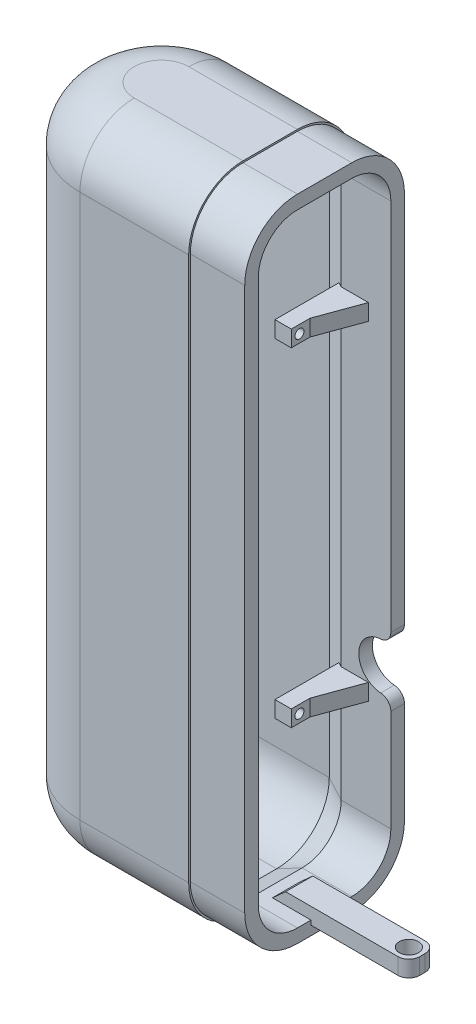
from build123d import *
from OCP.BRepFilletAPI import BRepFilletAPI_MakeChamfer

# Parameters (mm, degrees)
BOSS_EXTRUDE1_DEPTH      = 76.2
FILLET1_R                = 12.7
SHELL1_T                 = -0.4
EXTRUDE_THIN1_DEPTH      = 12.7
EXTRUDE_THIN1_DEPTH_BACK = 6.35
CHAMFER1_SIZE            = 7.46
CHAMFER1_SIZE_2          = 3.96655236
SKETCH6_W                = 17.539309582
SKETCH6_H                = 3.81
SKETCH6_R                = 1.054294776
BOSS_EXTRUDE3_DEPTH      = 3.81
CHAMFER2_SIZE            = 10
CHAMFER2_SIZE2           = 3.639702343
SKETCH7_W                = 33.02
SKETCH7_H                = 6.35
BOSS_EXTRUDE4_DEPTH      = 3.81
CHAMFER3_SIZE            = 3.81
CHAMFER3_SIZE_2          = 4.231433681
SKETCH8_R                = 2.25
CUT_EXTRUDE1_DEPTH       = 160.403972974
FILLET2_R                = 2.54
SKETCH9_R                = 5.461
CUT_EXTRUDE2_DEPTH       = 104.511048806
FILLET3_R                = 2.54


with BuildPart() as part:
    # Sketch1 → Boss-Extrude1 (new, symmetric)
    with BuildSketch(Plane(origin=(0, 0, 0), x_dir=(1, 0, 0), z_dir=(0, 1, 0))):
        with BuildLine():
            Line((0, -19.05), (25.4, -19.05))
            Line((25.4, -19.05), (25.4, 19.05))
            Line((25.4, 19.05), (0, 19.05))
            ThreePointArc((0, 19.05), (-19.05, 0), (0, -19.05))
        make_face()
    extrude(amount=BOSS_EXTRUDE1_DEPTH, both=True)

    # Fillet1
    fillet1_edges = [part.edges().sort_by_distance(p)[0] for p in [
        (12.7, 76.2, -19.05),
        (-19.05, 76.2, 0),
        (12.7, -76.2, -19.05),
        (12.7, -76.2, 19.05),
        (-19.05, -76.2, 0),
        (12.7, 76.2, 19.05),
    ]]
    fillet(fillet1_edges, radius=FILLET1_R)

    # Shell1
    shell1_openings = [part.faces().sort_by_distance(p)[0] for p in [
        (25.4, 0, 0),
    ]]
    offset(amount=SHELL1_T, openings=shell1_openings, kind=Kind.INTERSECTION)

    # Sketch4 → Extrude-Thin1 (add, two sides: drawn at the far end of the back side and taken through both)
    with BuildSketch(Plane(origin=(25.4, 0, 0), x_dir=(0, 0, -1), z_dir=(1, 0, 0)).offset(-EXTRUDE_THIN1_DEPTH_BACK)):
        with BuildLine():
            Line((18.65, 63.5), (18.65, -63.5))
            ThreePointArc((18.65, -63.5), (15.047413409, -72.197413409), (6.35, -75.8))
            Line((6.35, -75.8), (-6.35, -75.8))
            ThreePointArc((-6.35, -75.8), (-15.047413409, -72.197413409), (-18.65, -63.5))
            Line((-18.65, -63.5), (-18.65, 63.5))
            ThreePointArc((-18.65, 63.5), (-15.047413409, 72.197413409), (-6.35, 75.8))
            Line((-6.35, 75.8), (6.35, 75.8))
            ThreePointArc((6.35, 75.8), (15.047413409, 72.197413409), (18.65, 63.5))
        make_face()
        with BuildLine():
            Line((15.475, 63.5), (15.475, -63.5))
            ThreePointArc((15.475, -63.5), (12.802349378, -69.952349378), (6.35, -72.625))
            Line((6.35, -72.625), (-6.35, -72.625))
            ThreePointArc((-6.35, -72.625), (-12.802349378, -69.952349378), (-15.475, -63.5))
            Line((-15.475, -63.5), (-15.475, 63.5))
            ThreePointArc((-15.475, 63.5), (-12.802349378, 69.952349378), (-6.35, 72.625))
            Line((-6.35, 72.625), (6.35, 72.625))
            ThreePointArc((6.35, 72.625), (12.802349378, 69.952349378), (15.475, 63.5))
        make_face(mode=Mode.SUBTRACT)
    extrude(amount=EXTRUDE_THIN1_DEPTH + EXTRUDE_THIN1_DEPTH_BACK)

    # Chamfer1
    # the kernel refuses this chamfer: 7.46, 3.96655236 mm, written as the material it takes off along each edge
    with BuildSketch(Plane(origin=(19.05, 63.5, -15.475), x_dir=(0.9998355423896509, 0, 0.01813527431257697), z_dir=(0, -1, 0))) as chamfer1_piece_1_section:
        Polygon((CHAMFER1_SIZE * 0.99983554239, -CHAMFER1_SIZE * 0.0181352743126), (-CHAMFER1_SIZE_2 * 0.0181352743135, -CHAMFER1_SIZE_2 * 0.999835542439), (0, 0), align=None)
    chamfer1_piece_1 = extrude(amount=127, mode=Mode.PRIVATE)
    chamfer1_piece_1 = split(chamfer1_piece_1, bisect_by=Plane(origin=(21.815261342, 60.108381876, -18.65), z_dir=(0, 0, 1)), keep=Keep.TOP, mode=Mode.PRIVATE)
    add(chamfer1_piece_1, mode=Mode.SUBTRACT)
    with BuildSketch(Plane(origin=(19.05, 63.5, -6.35), x_dir=(0, 1, 0), z_dir=(0, 0, 1))) as chamfer1_piece_2_section:
        Polygon((9.125, -CHAMFER1_SIZE), (9.125 + CHAMFER1_SIZE_2, 0), (9.125, 0), align=None)
    chamfer1_piece_2 = revolve(axis=Axis((19.05, 63.5, -6.35), (-1, 0, 0)), revolution_arc=90, mode=Mode.PRIVATE)
    chamfer1_piece_2 = chamfer1_piece_2 & Plane(origin=(21.967036343, 63.5, -6.35), x_dir=(0, 0, -1), z_dir=(-1, 0, 0)) * Cylinder(12.3, 53, mode=Mode.PRIVATE)
    add(chamfer1_piece_2, mode=Mode.SUBTRACT)
    with BuildSketch(Plane(origin=(19.05, -63.5, -6.35), x_dir=(0, 0, -1), z_dir=(0, 1, 0))) as chamfer1_piece_3_section:
        Polygon((9.125, -CHAMFER1_SIZE), (9.125 + CHAMFER1_SIZE_2, 0), (9.125, 0), align=None)
    chamfer1_piece_3 = revolve(axis=Axis((19.05, -63.5, -6.35), (-1, 0, 0)), revolution_arc=90, mode=Mode.PRIVATE)
    chamfer1_piece_3 = chamfer1_piece_3 & Plane(origin=(21.967036343, -63.5, -6.35), x_dir=(0, 0, -1), z_dir=(-1, 0, 0)) * Cylinder(12.3, 53, mode=Mode.PRIVATE)
    add(chamfer1_piece_3, mode=Mode.SUBTRACT)
    with BuildSketch(Plane(origin=(19.05, 72.625, 6.35), x_dir=(0.9998355423896509, -0.01813527431257697, 0), z_dir=(0, 0, -1))) as chamfer1_piece_4_section:
        Polygon((CHAMFER1_SIZE * 0.99983554239, -CHAMFER1_SIZE * 0.0181352743126), (-CHAMFER1_SIZE_2 * 0.0181352743135, -CHAMFER1_SIZE_2 * 0.999835542439), (0, 0), align=None)
    chamfer1_piece_4 = extrude(amount=12.7, mode=Mode.PRIVATE)
    chamfer1_piece_4 = split(chamfer1_piece_4, bisect_by=Plane(origin=(21.637658595, 75.8, 3.947497634), z_dir=(0, -1, 0)), keep=Keep.TOP, mode=Mode.PRIVATE)
    add(chamfer1_piece_4, mode=Mode.SUBTRACT)
    with BuildSketch(Plane(origin=(19.05, -72.625, -6.35), x_dir=(0.9998355423896509, 0.01813527431257697, 0), z_dir=(0, 0, 1))) as chamfer1_piece_5_section:
        Polygon((CHAMFER1_SIZE * 0.99983554239, -CHAMFER1_SIZE * 0.0181352743126), (-CHAMFER1_SIZE_2 * 0.0181352743135, -CHAMFER1_SIZE_2 * 0.999835542439), (0, 0), align=None)
    chamfer1_piece_5 = extrude(amount=12.7, mode=Mode.PRIVATE)
    chamfer1_piece_5 = split(chamfer1_piece_5, bisect_by=Plane(origin=(21.637658595, -75.8, -3.947497634), z_dir=(0, 1, 0)), keep=Keep.TOP, mode=Mode.PRIVATE)
    add(chamfer1_piece_5, mode=Mode.SUBTRACT)
    with BuildSketch(Plane(origin=(19.05, 63.5, 6.35), x_dir=(0, 0, 1), z_dir=(0, -1, 0))) as chamfer1_piece_6_section:
        Polygon((9.125, -CHAMFER1_SIZE), (9.125 + CHAMFER1_SIZE_2, 0), (9.125, 0), align=None)
    chamfer1_piece_6 = revolve(axis=Axis((19.05, 63.5, 6.35), (-1, 0, 0)), revolution_arc=90, mode=Mode.PRIVATE)
    chamfer1_piece_6 = chamfer1_piece_6 & Plane(origin=(21.967036343, 63.5, 6.35), x_dir=(0, 0, 1), z_dir=(1, 0, 0)) * Cylinder(12.3, 53, mode=Mode.PRIVATE)
    add(chamfer1_piece_6, mode=Mode.SUBTRACT)
    with BuildSketch(Plane(origin=(19.05, -63.5, 6.35), x_dir=(0, -1, 0), z_dir=(0, 0, -1))) as chamfer1_piece_7_section:
        Polygon((9.125, -CHAMFER1_SIZE), (9.125 + CHAMFER1_SIZE_2, 0), (9.125, 0), align=None)
    chamfer1_piece_7 = revolve(axis=Axis((19.05, -63.5, 6.35), (-1, 0, 0)), revolution_arc=90, mode=Mode.PRIVATE)
    chamfer1_piece_7 = chamfer1_piece_7 & Plane(origin=(21.967036343, -63.5, 6.35), x_dir=(0, 0, 1), z_dir=(1, 0, 0)) * Cylinder(12.3, 53, mode=Mode.PRIVATE)
    add(chamfer1_piece_7, mode=Mode.SUBTRACT)
    with BuildSketch(Plane(origin=(19.05, -63.5, 15.475), x_dir=(0.9998355423896509, 0, -0.01813527431257697), z_dir=(0, 1, 0))) as chamfer1_piece_8_section:
        Polygon((CHAMFER1_SIZE * 0.99983554239, -CHAMFER1_SIZE * 0.0181352743126), (-CHAMFER1_SIZE_2 * 0.0181352743135, -CHAMFER1_SIZE_2 * 0.999835542439), (0, 0), align=None)
    chamfer1_piece_8 = extrude(amount=127, mode=Mode.PRIVATE)
    chamfer1_piece_8 = split(chamfer1_piece_8, bisect_by=Plane(origin=(21.815261342, -60.108381876, 18.65), z_dir=(0, 0, -1)), keep=Keep.TOP, mode=Mode.PRIVATE)
    add(chamfer1_piece_8, mode=Mode.SUBTRACT)

    # Sketch6 → Boss-Extrude3 (add)
    # profile 1 of 2: a face of its own
    with BuildSketch(Plane(origin=(25.4, 0, 0), x_dir=(0, 0, -1), z_dir=(1, 0, 0))):
        with Locations((9.880345209, 38.431496192)):
            Rectangle(SKETCH6_W, SKETCH6_H)
        with Locations(Location((3.015690418, 38.431496192, 0), (0, 0, 180))):
            Circle(SKETCH6_R, mode=Mode.SUBTRACT)
    # profile 2 of 2: a face of its own
    with BuildSketch(Plane(origin=(25.4, 0, 0), x_dir=(0, 0, -1), z_dir=(1, 0, 0))):
        with Locations((9.880345209, -38.410993514)):
            Rectangle(SKETCH6_W, SKETCH6_H)
        with Locations(Location((3.015690418, -38.410993514, 0), (0, 0, 180))):
            Circle(SKETCH6_R, mode=Mode.SUBTRACT)
    extrude(amount=BOSS_EXTRUDE3_DEPTH)

    # Chamfer2: one chamfer whose edges measure the first distance from different faces: ONE call of the kernel's chamfer builder (chamfer() names one face for all edges)
    chamfer2_edges_1 = [part.edges().sort_by_distance(p)[0] for p in [
        (29.21, -38.410993514, -15.475),
    ]]
    chamfer2_side_1 = [part.faces().sort_by_distance(p)[0] for p in [
        (29.21, -38.410993514, -8.652510406),
    ]]
    chamfer2_edges_2 = [part.edges().sort_by_distance(p)[0] for p in [
        (29.21, 38.431496192, -15.475),
    ]]
    chamfer2_side_2 = [part.faces().sort_by_distance(p)[0] for p in [
        (29.21, 38.431496192, -8.652510406),
    ]]
    chamfer2 = BRepFilletAPI_MakeChamfer(part.part.solid().wrapped)
    for e in chamfer2_edges_1:
        chamfer2.Add(CHAMFER2_SIZE, CHAMFER2_SIZE2, e.wrapped, chamfer2_side_1[0].wrapped)  # the first distance lies on this face
    for e in chamfer2_edges_2:
        chamfer2.Add(CHAMFER2_SIZE, CHAMFER2_SIZE2, e.wrapped, chamfer2_side_2[0].wrapped)  # the first distance lies on this face
    add(Compound.cast(chamfer2.Shape()), mode=Mode.REPLACE)

    # Sketch7 → Boss-Extrude4 (add)
    with BuildSketch(Plane(origin=(0, -73.66, 0), x_dir=(1, 0, 0), z_dir=(0, 1, 0))):
        with Locations((44.45, 0)):
            Rectangle(SKETCH7_W, SKETCH7_H)
    extrude(amount=BOSS_EXTRUDE4_DEPTH)

    # Chamfer3
    # the kernel refuses this chamfer: 4.231433681, 3.81 mm, written as the material it takes off along each edge
    with BuildSketch(Plane(origin=(27.94, -69.85, -3.175), x_dir=(-0.03204434000819545, -0.9994864482690294, 0), z_dir=(0, 0, 1))) as chamfer3_piece_1_section:
        Polygon((CHAMFER3_SIZE * 0.999486448269, CHAMFER3_SIZE * 0.0320443400082), (-CHAMFER3_SIZE_2 * 0.032044340012, CHAMFER3_SIZE_2 * 0.999486448387), (0, 0), align=None)
    chamfer3_piece_1 = extrude(amount=6.35, mode=Mode.PRIVATE)
    chamfer3_piece_1 = split(chamfer3_piece_1, bisect_by=Plane(origin=(28.695678786, -72.625, -2.695594609), z_dir=(0, 1, 0)), keep=Keep.TOP, mode=Mode.PRIVATE)
    add(chamfer3_piece_1, mode=Mode.SUBTRACT)

    # Sketch8 → Cut-Extrude1 (cut, through all)
    with BuildSketch(Plane(origin=(0, -69.85, 0), x_dir=(1, 0, 0), z_dir=(0, 1, 0))):
        with Locations(Location((57.785, 0, 0), (0, 0, 270))):
            Circle(SKETCH8_R)
    extrude(amount=-CUT_EXTRUDE1_DEPTH, mode=Mode.SUBTRACT)

    # Fillet2
    fillet2_edges = [part.edges().sort_by_distance(p)[0] for p in [
        (60.96, -71.755, -3.175),
        (60.96, -71.755, 3.175),
    ]]
    fillet(fillet2_edges, radius=FILLET2_R)

    # Sketch9 → Cut-Extrude2 (cut, through all)
    with BuildSketch(Plane.XY.offset(-15.475)):
        with Locations((36.068, -31.75)):
            Circle(SKETCH9_R)
    extrude(amount=-CUT_EXTRUDE2_DEPTH, mode=Mode.SUBTRACT)

    # Fillet3
    fillet3_edges = [part.edges().sort_by_distance(p)[0] for p in [
        (38.1, -26.681124681, -17.0625),
        (38.1, -36.818875319, -17.0625),
    ]]
    fillet(fillet3_edges, radius=FILLET3_R)


solid = part.part
